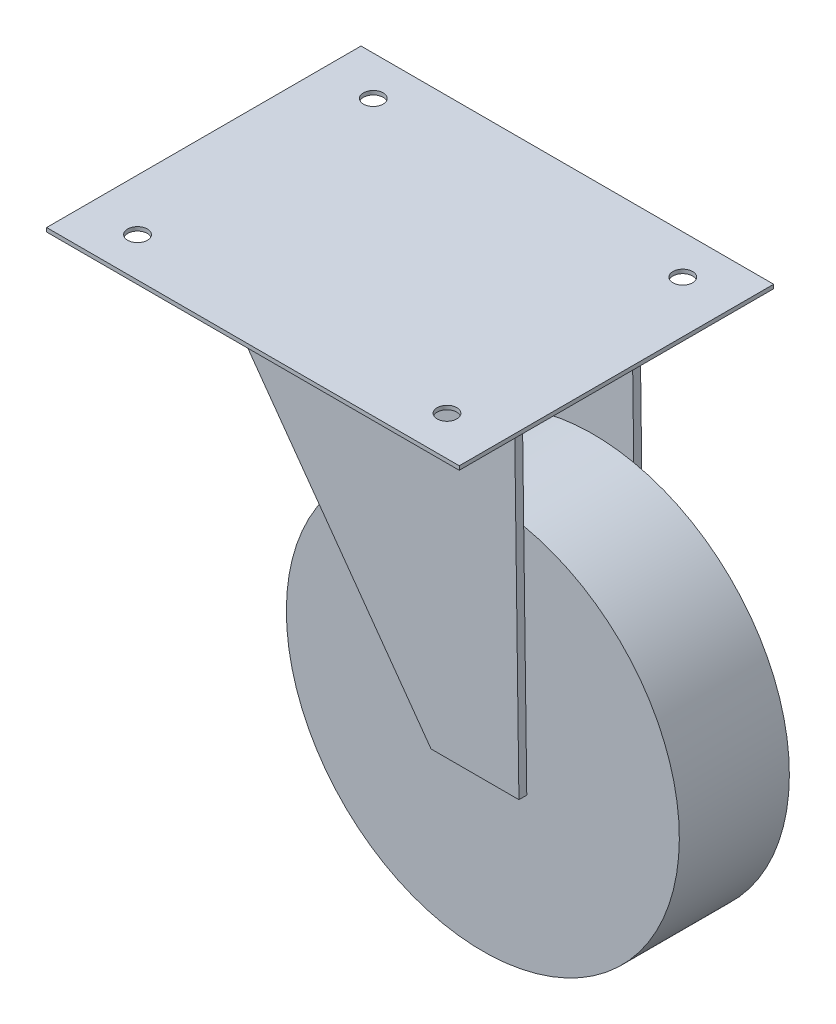
from build123d import *

# Parameters (mm, degrees)
SKETCH_1_W             = 105
SKETCH_1_H             = 80
SKETCH_1_R             = 2.5
EXTRUDE_1_DEPTH        = 1
EXTRUDE_START          = -14
SKETCH_2_R             = 50
EXTRUDE_2_DEPTH        = 28
EXTRUDE_3_DEPTH        = 2
PATTERN_LINEAR_1_COUNT = 2
PATTERN_LINEAR_1_PITCH = 30


with BuildPart() as part:
    # Эскиз1 → Бобышка-Вытянуть1 (new body)
    with BuildSketch(Plane(origin=(0, 0, 0), x_dir=(1, 0, 0), z_dir=(0, 1, 0))):
        Rectangle(SKETCH_1_W, SKETCH_1_H)
        with Locations((-39.375, 30)):
            Circle(SKETCH_1_R, mode=Mode.SUBTRACT)
        with Locations((39.375, 30)):
            Circle(SKETCH_1_R, mode=Mode.SUBTRACT)
        with Locations((39.375, -30)):
            Circle(SKETCH_1_R, mode=Mode.SUBTRACT)
        with Locations((-39.375, -30)):
            Circle(SKETCH_1_R, mode=Mode.SUBTRACT)
    extrude(amount=EXTRUDE_1_DEPTH)



with BuildPart() as body_2:
    # Эскиз2 → Бобышка-Вытянуть2 (new body)
    with BuildSketch(Plane.XY.offset(EXTRUDE_START)):
        with Locations((32.5, -79)):
            Circle(SKETCH_2_R)
    extrude(amount=EXTRUDE_2_DEPTH)


with BuildPart() as part_1:
    add(part.part)

    add(body_2.part)  # Бобышка-Вытянуть3 merges body 2
    # Эскиз3 → Бобышка-Вытянуть3 (add)
    with BuildSketch(Plane.XY.offset(14)):
        Polygon((21.319660113, -89), (43.680339887, -89), (42.5, 0), (-42.5, 0), align=None)
    extrude_3 = extrude(amount=EXTRUDE_3_DEPTH)

    # Линейный массив1: Бобышка-Вытянуть3 ×2
    with Locations(*[(0, 0, -i * PATTERN_LINEAR_1_PITCH) for i in range(1, PATTERN_LINEAR_1_COUNT)]):
        add(extrude_3)


solid = part_1.part
